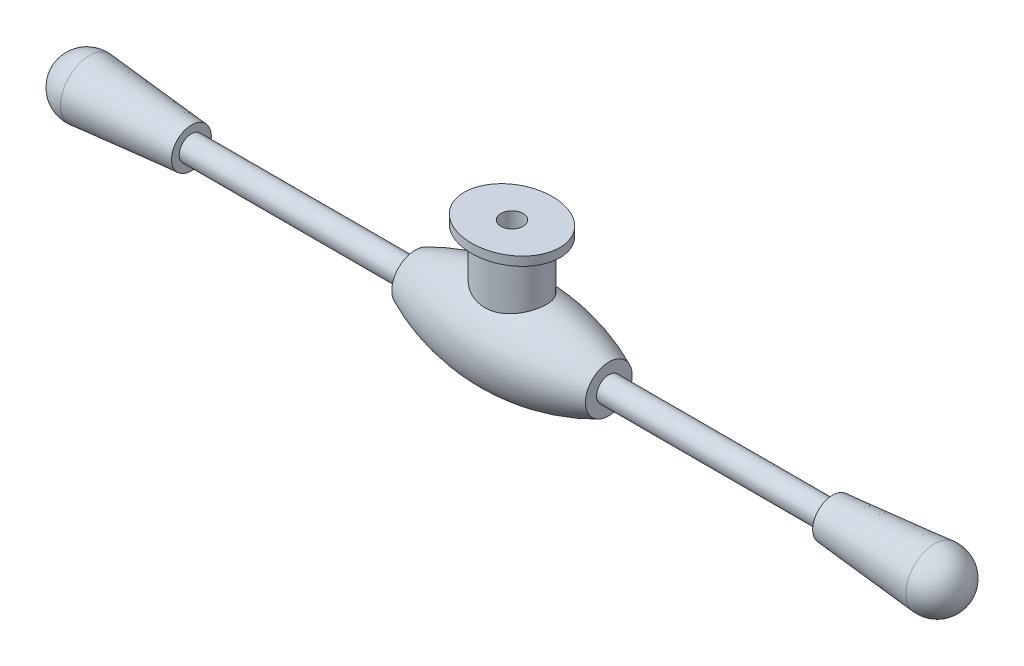
from build123d import *

# Parameters (mm, degrees)
SKETCH4_RX          = 1.9685
SKETCH4_RY          = 1.54305
BOSS_EXTRUDE2_DEPTH = 5.08
BOSS_EXTRUDE3_DEPTH = 0.508
SKETCH6_R           = 0.635
CUT_EXTRUDE2_DEPTH  = 27.625210039


# Read off the part's stored shape, not the designer's step: Boss-Extrude3
with BuildPart() as part:
    # Sketch3 → Revolve1 (revolve)
    with BuildSketch(Plane(origin=(0, 0, 0), x_dir=(-1, 0, 0), z_dir=(0, 1, 0))):
        with BuildLine():
            Line((-25.908, 0), (25.908, 0))
            ThreePointArc((25.908, 0), (25.372399433, -1.217244883), (24.113105869, -1.644717447))
            Line((24.113105869, -1.644717447), (18.288, -1.135086719))
            Line((18.288, -1.135086719), (18.288, -0.6985))
            Line((18.288, -0.6985), (5.5245, -0.6985))
            Line((5.5245, -0.6985), (5.5245, -1.3335))
            ThreePointArc((5.5245, -1.3335), (0, -2.54), (-5.5245, -1.3335))
            Line((-5.5245, -1.3335), (-5.5245, -0.6985))
            Line((-5.5245, -0.6985), (-18.288, -0.6985))
            Line((-18.288, -0.6985), (-18.288, -1.135086719))
            Line((-18.288, -1.135086719), (-24.113105869, -1.644717447))
            ThreePointArc((-24.113105869, -1.644717447), (-25.372399433, -1.217244883), (-25.908, 0))
        make_face()
    revolve(axis=Axis((25.908, 0, 0), (-1, 0, 0)))

    # Sketch4 → Boss-Extrude2 (add)
    with BuildSketch(Plane(origin=(0, 0, 0), x_dir=(-1, 0, 0), z_dir=(0, 1, 0))):
        with Locations((0, 0)):
            Ellipse(SKETCH4_RX, SKETCH4_RY)
    extrude(amount=BOSS_EXTRUDE2_DEPTH)

    # Boss-Extrude3 outline → Boss-Extrude3 (add)
    with BuildSketch(Plane(origin=(0, 5.08, 0), x_dir=(-1, 0, 0), z_dir=(0, 1, 0))):
        with BuildLine():
            add(Edge.make_bspline(
                [(2.7305, 0), (2.7305, 0.328264155), (2.559294063, 0.984792465), (1.681563155, 1.991576732), (0, 2.514032178), (-1.681563155, 1.991576732), (-2.559294063, 0.984792465), (-2.816102969, 0), (-2.559294063, -0.984792465), (-1.681563155, -1.991576732), (0, -2.514032178), (1.681563155, -1.991576732), (2.559294063, -0.984792465), (2.7305, -0.328264155), (2.7305, 0)],
                knots=[0, 0, 0, 0, 0.392699082, 0.785398163, 1.570796327, 2.35619449, 2.748893572, 3.141592654, 3.534291735, 3.926990817, 4.71238898, 5.497787144, 5.890486225, 6.283185307, 6.283185307, 6.283185307, 6.283185307], degree=3))
        make_face()
    extrude(amount=BOSS_EXTRUDE3_DEPTH)

    # Sketch6 → Cut-Extrude2 (cut, through all)
    with BuildSketch(Plane(origin=(0, 0, 0), x_dir=(-1, 0, 0), z_dir=(0, 1, 0))):
        with Locations(Location((0, 0, 0), (0, 0, 90))):
            Circle(SKETCH6_R)
    extrude(amount=CUT_EXTRUDE2_DEPTH, mode=Mode.SUBTRACT)


solid = part.part
